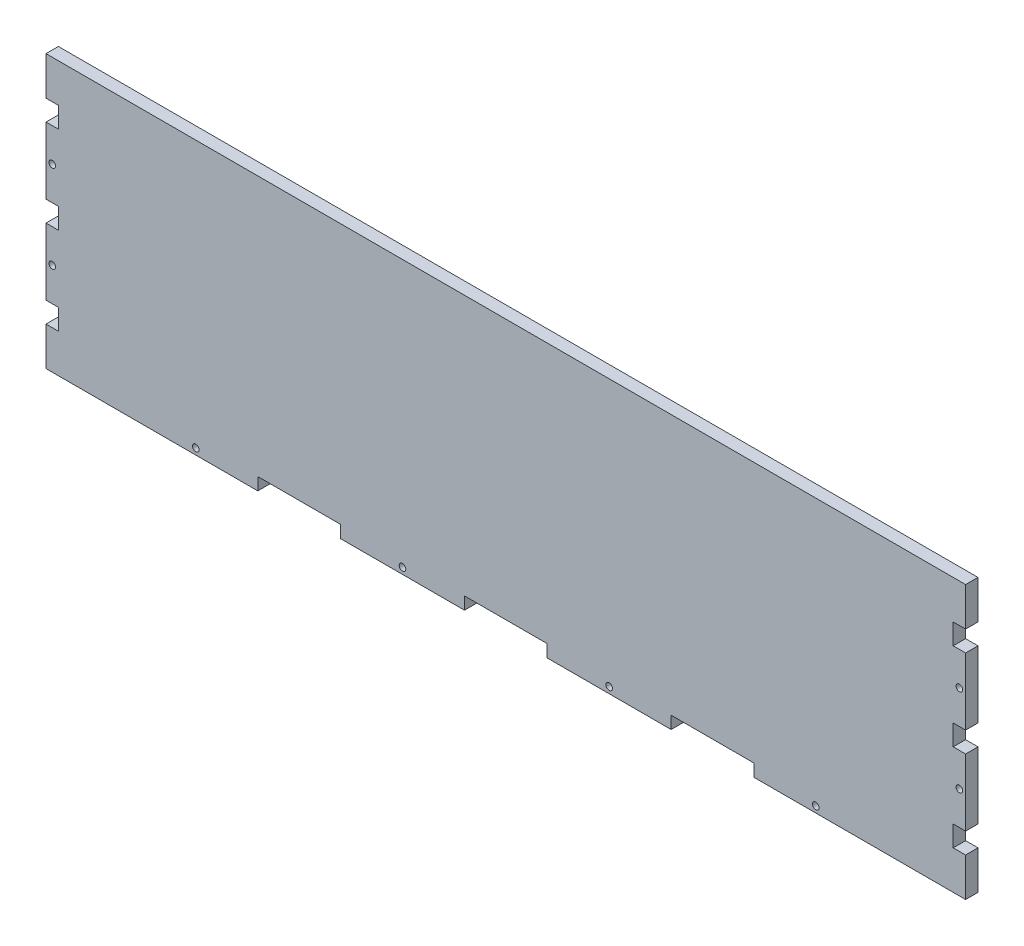
from build123d import *

# Parameters (mm, degrees)
SKETCH1_W           = 445
SKETCH1_H           = 132
BOSS_EXTRUDE1_DEPTH = 6
CUT_EXTRUDE1_REACH  = 234.16
SKETCH2_R           = 1.6
SKETCH2_W           = 6
SKETCH2_H           = 10
CUT_EXTRUDE2_REACH  = 234.16
SKETCH3_R           = 1.6
CUT_EXTRUDE3_REACH  = 234.16
SKETCH4_W           = 40
SKETCH4_H           = 6


with BuildPart() as part:
    # Sketch1 → Boss-Extrude1 (new body)
    with BuildSketch(Plane.XY):
        Rectangle(SKETCH1_W, SKETCH1_H)
    extrude(amount=BOSS_EXTRUDE1_DEPTH)

    # Sketch2 → Cut-Extrude1 (cut, up to next)
    with BuildSketch(Plane(origin=(0, 0, 0), x_dir=(-1, 0, 0), z_dir=(0, 0, -1)), mode=Mode.PRIVATE) as cut_extrude1_sk1:
        with Locations((219.5, 21.166064391)):
            Circle(SKETCH2_R)
    cut_extrude1_tool1 = extrude(cut_extrude1_sk1.sketch, amount=-CUT_EXTRUDE1_REACH, mode=Mode.PRIVATE) & part.part
    # Sketch2 → Cut-Extrude1 (cut, up to next)
    with BuildSketch(Plane(origin=(0, 0, 0), x_dir=(-1, 0, 0), z_dir=(0, 0, -1)), mode=Mode.PRIVATE) as cut_extrude1_sk2:
        with Locations((219.5, -21.166064391)):
            Circle(SKETCH2_R)
    cut_extrude1_tool2 = extrude(cut_extrude1_sk2.sketch, amount=-CUT_EXTRUDE1_REACH, mode=Mode.PRIVATE) & part.part
    # Sketch2 → Cut-Extrude1 (cut, up to next)
    with BuildSketch(Plane(origin=(0, 0, 0), x_dir=(-1, 0, 0), z_dir=(0, 0, -1)), mode=Mode.PRIVATE) as cut_extrude1_sk3:
        with Locations((-219.5, 21.166064391)):
            Circle(SKETCH2_R)
    cut_extrude1_tool3 = extrude(cut_extrude1_sk3.sketch, amount=-CUT_EXTRUDE1_REACH, mode=Mode.PRIVATE) & part.part
    # Sketch2 → Cut-Extrude1 (cut, up to next)
    with BuildSketch(Plane(origin=(0, 0, 0), x_dir=(-1, 0, 0), z_dir=(0, 0, -1)), mode=Mode.PRIVATE) as cut_extrude1_sk4:
        with Locations((-219.5, -21.166064391)):
            Circle(SKETCH2_R)
    cut_extrude1_tool4 = extrude(cut_extrude1_sk4.sketch, amount=-CUT_EXTRUDE1_REACH, mode=Mode.PRIVATE) & part.part
    # Sketch2 → Cut-Extrude1 (cut, up to next)
    with BuildSketch(Plane(origin=(0, 0, 0), x_dir=(-1, 0, 0), z_dir=(0, 0, -1)), mode=Mode.PRIVATE) as cut_extrude1_sk5:
        with Locations((219.5, 42.332128782)):
            Rectangle(SKETCH2_W, SKETCH2_H)
    cut_extrude1_tool5 = extrude(cut_extrude1_sk5.sketch, amount=-CUT_EXTRUDE1_REACH, mode=Mode.PRIVATE) & part.part
    # Sketch2 → Cut-Extrude1 (cut, up to next)
    with BuildSketch(Plane(origin=(0, 0, 0), x_dir=(-1, 0, 0), z_dir=(0, 0, -1)), mode=Mode.PRIVATE) as cut_extrude1_sk6:
        with Locations((219.5, -42.332128782)):
            Rectangle(SKETCH2_W, SKETCH2_H)
    cut_extrude1_tool6 = extrude(cut_extrude1_sk6.sketch, amount=-CUT_EXTRUDE1_REACH, mode=Mode.PRIVATE) & part.part
    # Sketch2 → Cut-Extrude1 (cut, up to next)
    with BuildSketch(Plane(origin=(0, 0, 0), x_dir=(-1, 0, 0), z_dir=(0, 0, -1)), mode=Mode.PRIVATE) as cut_extrude1_sk7:
        with Locations((-219.5, -42.332128782)):
            Rectangle(SKETCH2_W, SKETCH2_H)
    cut_extrude1_tool7 = extrude(cut_extrude1_sk7.sketch, amount=-CUT_EXTRUDE1_REACH, mode=Mode.PRIVATE) & part.part
    # Sketch2 → Cut-Extrude1 (cut, up to next)
    with BuildSketch(Plane(origin=(0, 0, 0), x_dir=(-1, 0, 0), z_dir=(0, 0, -1)), mode=Mode.PRIVATE) as cut_extrude1_sk8:
        with Locations((-219.5, 42.332128782)):
            Rectangle(SKETCH2_W, SKETCH2_H)
    cut_extrude1_tool8 = extrude(cut_extrude1_sk8.sketch, amount=-CUT_EXTRUDE1_REACH, mode=Mode.PRIVATE) & part.part
    # Sketch2 → Cut-Extrude1 (cut, up to next)
    with BuildSketch(Plane(origin=(0, 0, 0), x_dir=(-1, 0, 0), z_dir=(0, 0, -1)), mode=Mode.PRIVATE) as cut_extrude1_sk9:
        with Locations((219.5, 0)):
            Rectangle(SKETCH2_W, SKETCH2_H)
    cut_extrude1_tool9 = extrude(cut_extrude1_sk9.sketch, amount=-CUT_EXTRUDE1_REACH, mode=Mode.PRIVATE) & part.part
    # Sketch2 → Cut-Extrude1 (cut, up to next)
    with BuildSketch(Plane(origin=(0, 0, 0), x_dir=(-1, 0, 0), z_dir=(0, 0, -1)), mode=Mode.PRIVATE) as cut_extrude1_sk10:
        with Locations((-219.5, 0)):
            Rectangle(SKETCH2_W, SKETCH2_H)
    cut_extrude1_tool10 = extrude(cut_extrude1_sk10.sketch, amount=-CUT_EXTRUDE1_REACH, mode=Mode.PRIVATE) & part.part
    add(cut_extrude1_tool1.solids().sort_by_distance((-219.5, 21.166064, 0))[0], mode=Mode.SUBTRACT)
    add(cut_extrude1_tool2.solids().sort_by_distance((-219.5, -21.166064, 0))[0], mode=Mode.SUBTRACT)
    add(cut_extrude1_tool3.solids().sort_by_distance((219.5, 21.166064, 0))[0], mode=Mode.SUBTRACT)
    add(cut_extrude1_tool4.solids().sort_by_distance((219.5, -21.166064, 0))[0], mode=Mode.SUBTRACT)
    add(cut_extrude1_tool5.solids().sort_by_distance((-219.5, 42.332129, 0))[0], mode=Mode.SUBTRACT)
    add(cut_extrude1_tool6.solids().sort_by_distance((-219.5, -42.332129, 0))[0], mode=Mode.SUBTRACT)
    add(cut_extrude1_tool7.solids().sort_by_distance((219.5, -42.332129, 0))[0], mode=Mode.SUBTRACT)
    add(cut_extrude1_tool8.solids().sort_by_distance((219.5, 42.332129, 0))[0], mode=Mode.SUBTRACT)
    add(cut_extrude1_tool9.solids().sort_by_distance((-219.5, 0, 0))[0], mode=Mode.SUBTRACT)
    add(cut_extrude1_tool10.solids().sort_by_distance((219.5, 0, 0))[0], mode=Mode.SUBTRACT)

    # Sketch3 → Cut-Extrude2 (cut, up to next)
    with BuildSketch(Plane(origin=(0, 0, 0), x_dir=(-1, 0, 0), z_dir=(0, 0, -1)), mode=Mode.PRIVATE) as cut_extrude2_sk1:
        with Locations((-150, -63)):
            Circle(SKETCH3_R)
    cut_extrude2_tool1 = extrude(cut_extrude2_sk1.sketch, amount=-CUT_EXTRUDE2_REACH, mode=Mode.PRIVATE) & part.part
    # Sketch3 → Cut-Extrude2 (cut, up to next)
    with BuildSketch(Plane(origin=(0, 0, 0), x_dir=(-1, 0, 0), z_dir=(0, 0, -1)), mode=Mode.PRIVATE) as cut_extrude2_sk2:
        with Locations((-50, -63)):
            Circle(SKETCH3_R)
    cut_extrude2_tool2 = extrude(cut_extrude2_sk2.sketch, amount=-CUT_EXTRUDE2_REACH, mode=Mode.PRIVATE) & part.part
    # Sketch3 → Cut-Extrude2 (cut, up to next)
    with BuildSketch(Plane(origin=(0, 0, 0), x_dir=(-1, 0, 0), z_dir=(0, 0, -1)), mode=Mode.PRIVATE) as cut_extrude2_sk3:
        with Locations((50, -63)):
            Circle(SKETCH3_R)
    cut_extrude2_tool3 = extrude(cut_extrude2_sk3.sketch, amount=-CUT_EXTRUDE2_REACH, mode=Mode.PRIVATE) & part.part
    # Sketch3 → Cut-Extrude2 (cut, up to next)
    with BuildSketch(Plane(origin=(0, 0, 0), x_dir=(-1, 0, 0), z_dir=(0, 0, -1)), mode=Mode.PRIVATE) as cut_extrude2_sk4:
        with Locations((150, -63)):
            Circle(SKETCH3_R)
    cut_extrude2_tool4 = extrude(cut_extrude2_sk4.sketch, amount=-CUT_EXTRUDE2_REACH, mode=Mode.PRIVATE) & part.part
    add(cut_extrude2_tool1.solids().sort_by_distance((150, -63, 0))[0], mode=Mode.SUBTRACT)
    add(cut_extrude2_tool2.solids().sort_by_distance((50, -63, 0))[0], mode=Mode.SUBTRACT)
    add(cut_extrude2_tool3.solids().sort_by_distance((-50, -63, 0))[0], mode=Mode.SUBTRACT)
    add(cut_extrude2_tool4.solids().sort_by_distance((-150, -63, 0))[0], mode=Mode.SUBTRACT)

    # Sketch4 → Cut-Extrude3 (cut, up to next)
    with BuildSketch(Plane(origin=(0, 0, 0), x_dir=(-1, 0, 0), z_dir=(0, 0, -1)), mode=Mode.PRIVATE) as cut_extrude3_sk1:
        with Locations((100, -63)):
            Rectangle(SKETCH4_W, SKETCH4_H)
    cut_extrude3_tool1 = extrude(cut_extrude3_sk1.sketch, amount=-CUT_EXTRUDE3_REACH, mode=Mode.PRIVATE) & part.part
    # Sketch4 → Cut-Extrude3 (cut, up to next)
    with BuildSketch(Plane(origin=(0, 0, 0), x_dir=(-1, 0, 0), z_dir=(0, 0, -1)), mode=Mode.PRIVATE) as cut_extrude3_sk2:
        with Locations((0, -63)):
            Rectangle(SKETCH4_W, SKETCH4_H)
    cut_extrude3_tool2 = extrude(cut_extrude3_sk2.sketch, amount=-CUT_EXTRUDE3_REACH, mode=Mode.PRIVATE) & part.part
    # Sketch4 → Cut-Extrude3 (cut, up to next)
    with BuildSketch(Plane(origin=(0, 0, 0), x_dir=(-1, 0, 0), z_dir=(0, 0, -1)), mode=Mode.PRIVATE) as cut_extrude3_sk3:
        with Locations((-100, -63)):
            Rectangle(SKETCH4_W, SKETCH4_H)
    cut_extrude3_tool3 = extrude(cut_extrude3_sk3.sketch, amount=-CUT_EXTRUDE3_REACH, mode=Mode.PRIVATE) & part.part
    add(cut_extrude3_tool1.solids().sort_by_distance((-100, -63, 0))[0], mode=Mode.SUBTRACT)
    add(cut_extrude3_tool2.solids().sort_by_distance((0, -63, 0))[0], mode=Mode.SUBTRACT)
    add(cut_extrude3_tool3.solids().sort_by_distance((100, -63, 0))[0], mode=Mode.SUBTRACT)


solid = part.part
